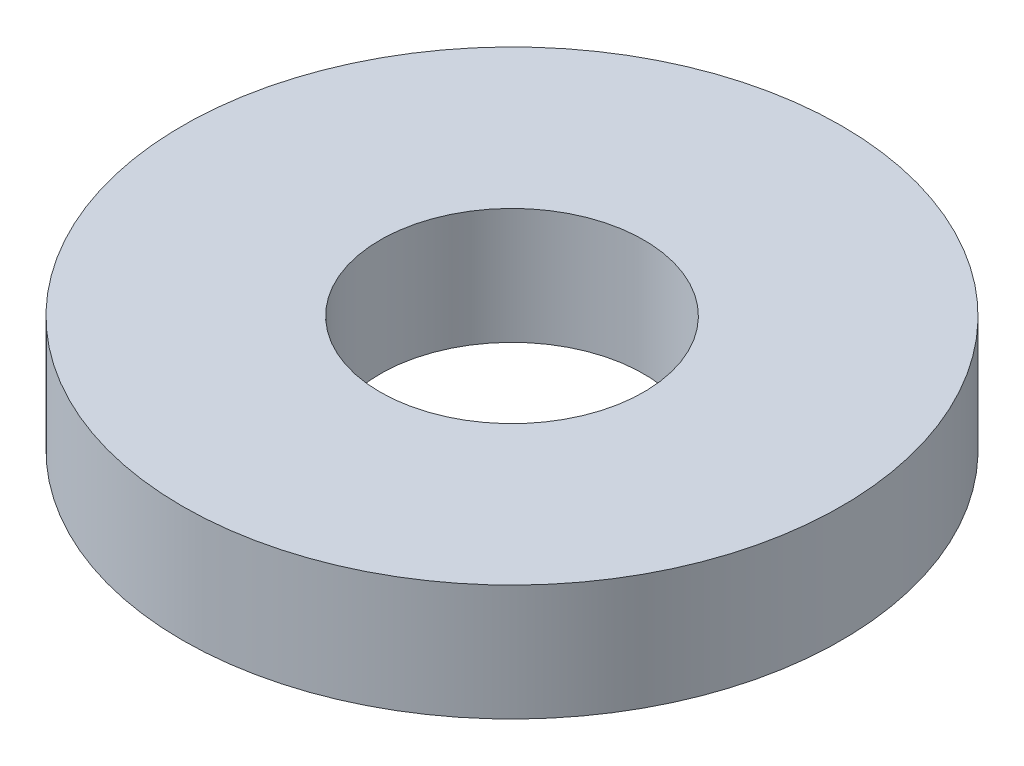
from build123d import *

# Parameters (mm, degrees)
SKETCH1_R           = 62.5
BOSS_EXTRUDE1_DEPTH = 22
SKETCH2_R           = 25
CUT_EXTRUDE1_DEPTH  = 92.08512502


with BuildPart() as part:
    # Sketch1 → Boss-Extrude1 (new body)
    with BuildSketch(Plane(origin=(0, 0, 0), x_dir=(1, 0, 0), z_dir=(0, 1, 0))):
        Circle(SKETCH1_R)
    extrude(amount=BOSS_EXTRUDE1_DEPTH)

    # Sketch2 → Cut-Extrude1 (cut, through all)
    with BuildSketch(Plane(origin=(0, 0, 0), x_dir=(1, 0, 0), z_dir=(0, 1, 0))):
        Circle(SKETCH2_R)
    extrude(amount=CUT_EXTRUDE1_DEPTH, mode=Mode.SUBTRACT)


solid = part.part
